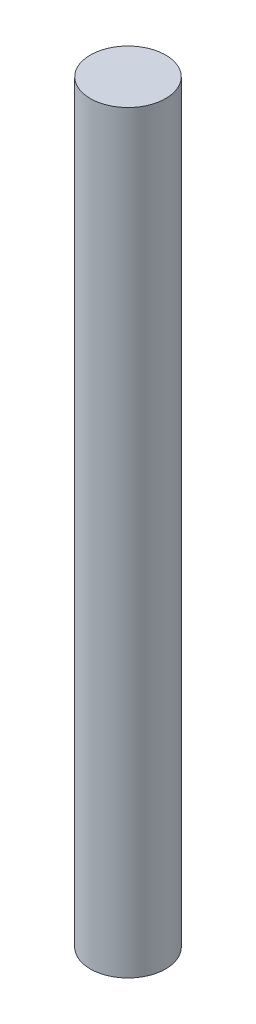
from build123d import *

# Parameters (mm, degrees)
SKETCH1_R           = 6.35
BOSS_EXTRUDE1_DEPTH = 127


with BuildPart() as part:
    # Sketch1 → Boss-Extrude1 (new body)
    with BuildSketch(Plane(origin=(0, 0, 0), x_dir=(1, 0, 0), z_dir=(0, 1, 0))):
        with Locations((-4.437719867, -4.54193157)):
            Circle(SKETCH1_R)
    extrude(amount=BOSS_EXTRUDE1_DEPTH)


solid = part.part
